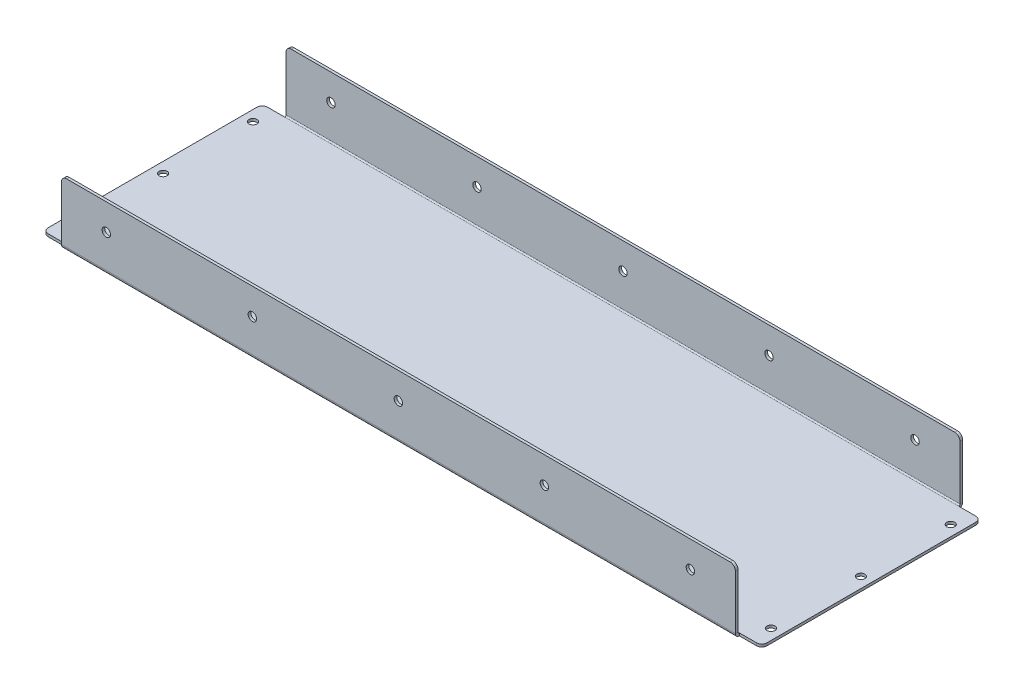
from build123d import *

# Parameters (mm, degrees)
SKETCH1_W                      = 272
SKETCH1_H                      = 84
BASE_FLANGE1_DEPTH             = 1
EDGE_FLANGE1_STRIP_W           = 5
EDGE_FLANGE1_STRIP_H           = 1
EDGE_FLANGE1_STRIP_CUT_DEPTH   = 272
EDGE_FLANGE1_STRIP_2_W         = 5
EDGE_FLANGE1_STRIP_2_H         = 1
EDGE_FLANGE1_STRIP_CUT_2_DEPTH = 272
EDGE_FLANGE1_DEPTH             = 272
EDGE_FLANGE1_BEND_DEPTH        = 272
CUT_EXTRUDE1_START             = -78.427547771
CUT_EXTRUDE1_DEPTH             = 8.5
CUT_EXTRUDE1_START_2           = 185.072452229
CUT_EXTRUDE1_2_DEPTH           = 8.5
SKETCH13_R                     = 1.6
CUT_EXTRUDE2_DEPTH             = 100
SKETCH14_R                     = 1.5
CUT_EXTRUDE3_DEPTH             = 100
FILLET1_R                      = 2
FILLET2_R                      = 2
FILLET3_R                      = 2
FILLET4_R                      = 2
FILLET5_R                      = 2
FILLET6_R                      = 2
FILLET7_R                      = 2
FILLET8_R                      = 2


# Read off the part's stored shape, not the designer's step: Cut-Extrude1
# Sheet-metal steps are written as plain solids
with BuildPart() as part:
    # Sketch1 → Base-Flange1 (new body)
    with BuildSketch(Plane(origin=(0, 0, 0), x_dir=(1, 0, 0), z_dir=(0, 1, 0))):
        with Locations((57.572452229, -1.800955414)):
            Rectangle(SKETCH1_W, SKETCH1_H)
    extrude(amount=-BASE_FLANGE1_DEPTH)

    # Edge-Flange1 strip (across the edge) → Edge-Flange1 strip cut (cut)
    with BuildSketch(Plane(origin=(-78.427547771, 0, 43.800955414), x_dir=(0, 0, -1), z_dir=(1, 0, 0))):
        with Locations((-2, -0.5)):
            Rectangle(EDGE_FLANGE1_STRIP_W, EDGE_FLANGE1_STRIP_H)
    extrude(amount=EDGE_FLANGE1_STRIP_CUT_DEPTH, mode=Mode.SUBTRACT)

    # Edge-Flange1 strip 2 (across the edge) → Edge-Flange1 strip cut 2 (cut)
    with BuildSketch(Plane(origin=(193.572452229, 0, -40.199044586), x_dir=(0, 0, 1), z_dir=(-1, 0, 0))):
        with Locations((-2, -0.5)):
            Rectangle(EDGE_FLANGE1_STRIP_2_W, EDGE_FLANGE1_STRIP_2_H)
    extrude(amount=EDGE_FLANGE1_STRIP_CUT_2_DEPTH, mode=Mode.SUBTRACT)

    # Edge-Flange1 section (across the edge) → Edge-Flange1 (add)
    with BuildSketch(Plane(origin=(-78.427547771, 0, 43.800955414), x_dir=(0, 0, -1), z_dir=(1, 0, 0))):
        with BuildLine():
            Line((-1, 0.5), (-1, 23))
            Line((-1, 23), (0, 23))
            Line((0, 23), (0, 0.5))
            ThreePointArc((0, 0.5), (0.146446609, 0.146446609), (0.5, 0))
            Line((0.5, 0), (0.5, -1))
            ThreePointArc((0.5, -1), (-0.560660172, -0.560660172), (-1, 0.5))
        make_face()
    extrude(amount=EDGE_FLANGE1_DEPTH)

    # Edge-Flange1 section 2 (across the edge) → Edge-Flange1 bend (add)
    with BuildSketch(Plane(origin=(193.572452229, 0, -40.199044586), x_dir=(0, 0, 1), z_dir=(-1, 0, 0))):
        with BuildLine():
            Line((-1, 0.5), (-1, 23))
            Line((-1, 23), (0, 23))
            Line((0, 23), (0, 0.5))
            ThreePointArc((0, 0.5), (0.146446609, 0.146446609), (0.5, 0))
            Line((0.5, 0), (0.5, -1))
            ThreePointArc((0.5, -1), (-0.560660172, -0.560660172), (-1, 0.5))
        make_face()
    extrude(amount=EDGE_FLANGE1_BEND_DEPTH)

    # Cut-Extrude1 outline → Cut-Extrude1 (cut)
    with BuildSketch(Plane.YZ.offset(CUT_EXTRUDE1_START)):
        with BuildLine():
            ThreePointArc((0.5, -40.199044586), (0.146446609, -40.052597977), (0, -39.699044586))
            Line((0, -39.699044586), (-1, -39.699044586))
            ThreePointArc((-1, -39.699044586), (-0.560660172, -40.759704758), (0.5, -41.199044586))
            Line((0.5, -41.199044586), (23, -41.199044586))
            Line((23, -41.199044586), (23, -40.199044586))
            Line((23, -40.199044586), (0.5, -40.199044586))
        make_face()
        with BuildLine():
            ThreePointArc((0.5, 44.800955414), (-0.560660172, 44.361615586), (-1, 43.300955414))
            Line((-1, 43.300955414), (0, 43.300955414))
            ThreePointArc((0, 43.300955414), (0.146446609, 43.654508805), (0.5, 43.800955414))
            Line((0.5, 43.800955414), (23, 43.800955414))
            Line((23, 43.800955414), (23, 44.800955414))
            Line((23, 44.800955414), (0.5, 44.800955414))
        make_face()
    extrude(amount=CUT_EXTRUDE1_DEPTH, mode=Mode.SUBTRACT)

    # Cut-Extrude1 2 outline → Cut-Extrude1 2 (cut)
    with BuildSketch(Plane.YZ.offset(CUT_EXTRUDE1_START_2)):
        with BuildLine():
            ThreePointArc((0.5, -40.199044586), (0.146446609, -40.052597977), (0, -39.699044586))
            Line((0, -39.699044586), (-1, -39.699044586))
            ThreePointArc((-1, -39.699044586), (-0.560660172, -40.759704758), (0.5, -41.199044586))
            Line((0.5, -41.199044586), (23, -41.199044586))
            Line((23, -41.199044586), (23, -40.199044586))
            Line((23, -40.199044586), (0.5, -40.199044586))
        make_face()
        with BuildLine():
            ThreePointArc((0.5, 44.800955414), (-0.560660172, 44.361615586), (-1, 43.300955414))
            Line((-1, 43.300955414), (0, 43.300955414))
            ThreePointArc((0, 43.300955414), (0.146446609, 43.654508805), (0.5, 43.800955414))
            Line((0.5, 43.800955414), (23, 43.800955414))
            Line((23, 43.800955414), (23, 44.800955414))
            Line((23, 44.800955414), (0.5, 44.800955414))
        make_face()
    extrude(amount=CUT_EXTRUDE1_2_DEPTH, mode=Mode.SUBTRACT)

    # Sketch13 → Cut-Extrude2 (cut)
    with BuildSketch(Plane(origin=(0, 0, -41.199044586), x_dir=(-1, 0, 0), z_dir=(0, 0, -1))):
        with Locations(Location((-168.072452229, 13, 0), (0, 0, 90))):
            Circle(SKETCH13_R)
        with Locations(Location((-112.822452229, 13, 0), (0, 0, 90))):
            Circle(SKETCH13_R)
        with Locations(Location((-57.572452229, 13, 0), (0, 0, 90))):
            Circle(SKETCH13_R)
        with Locations(Location((-2.322452229, 13, 0), (0, 0, 90))):
            Circle(SKETCH13_R)
        with Locations(Location((52.927547771, 13, 0), (0, 0, 90))):
            Circle(SKETCH13_R)
    extrude(amount=-CUT_EXTRUDE2_DEPTH, mode=Mode.SUBTRACT)

    # Sketch14 → Cut-Extrude3 (cut)
    with BuildSketch(Plane(origin=(0, 0, 0), x_dir=(1, 0, 0), z_dir=(0, 1, 0))):
        with Locations(Location((-74.427547771, -1.800955414, 0), (0, 0, 270))):
            Circle(SKETCH14_R)
        with Locations(Location((-74.427547771, 32.199044586, 0), (0, 0, 270))):
            Circle(SKETCH14_R)
        with Locations(Location((-74.427547771, -35.800955414, 0), (0, 0, 270))):
            Circle(SKETCH14_R)
        with Locations(Location((189.572452229, -35.800955414, 0), (0, 0, 270))):
            Circle(SKETCH14_R)
        with Locations(Location((189.572452229, -1.800955414, 0), (0, 0, 270))):
            Circle(SKETCH14_R)
        with Locations(Location((189.572452229, 32.199044586, 0), (0, 0, 270))):
            Circle(SKETCH14_R)
    extrude(amount=-CUT_EXTRUDE3_DEPTH, mode=Mode.SUBTRACT)

    # Fillet1
    fillet1_edges = [part.edges().sort_by_distance(p)[0] for p in [
        (193.572452229, -0.5, -39.699044586),
    ]]
    fillet(fillet1_edges, radius=FILLET1_R)

    # Fillet2
    fillet2_edges = [part.edges().sort_by_distance(p)[0] for p in [
        (193.572452229, -0.5, 43.300955414),
    ]]
    fillet(fillet2_edges, radius=FILLET2_R)

    # Fillet3
    fillet3_edges = [part.edges().sort_by_distance(p)[0] for p in [
        (-78.427547771, -0.5, -39.699044586),
    ]]
    fillet(fillet3_edges, radius=FILLET3_R)

    # Fillet4
    fillet4_edges = [part.edges().sort_by_distance(p)[0] for p in [
        (-78.427547771, -0.5, 43.300955414),
    ]]
    fillet(fillet4_edges, radius=FILLET4_R)

    # Fillet5
    fillet5_edges = [part.edges().sort_by_distance(p)[0] for p in [
        (185.072452229, 23, -40.699044586),
    ]]
    fillet(fillet5_edges, radius=FILLET5_R)

    # Fillet6
    fillet6_edges = [part.edges().sort_by_distance(p)[0] for p in [
        (-69.927547771, 23, -40.699044586),
    ]]
    fillet(fillet6_edges, radius=FILLET6_R)

    # Fillet7
    fillet7_edges = [part.edges().sort_by_distance(p)[0] for p in [
        (185.072452229, 23, 44.300955414),
    ]]
    fillet(fillet7_edges, radius=FILLET7_R)

    # Fillet8
    fillet8_edges = [part.edges().sort_by_distance(p)[0] for p in [
        (-69.927547771, 23, 44.300955414),
    ]]
    fillet(fillet8_edges, radius=FILLET8_R)


solid = part.part
